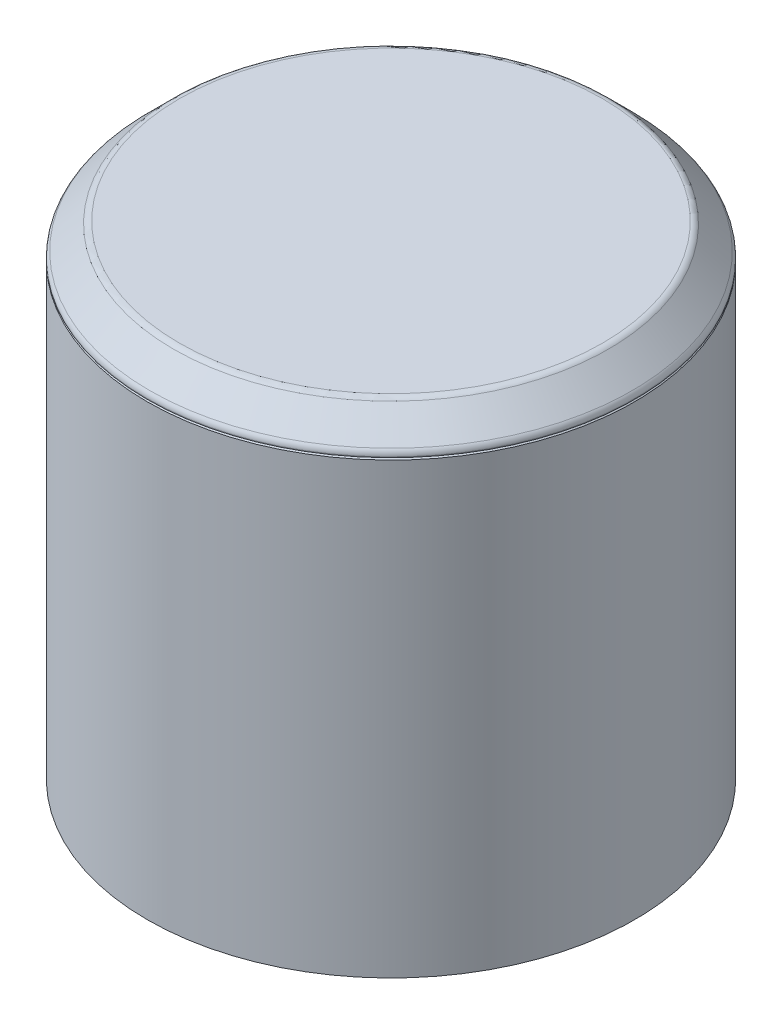
from build123d import *

# Parameters (mm, degrees)
IZIM2_R                     = 59.5
Y_KSEKLIK_EKSTR_ZYON1_DEPTH = 8
PAH1_SIZE                   = 0.5
PAH2_SIZE                   = 7
RADYUS1_R                   = 2


with BuildPart() as part:
    # Çizim1 → Döndür1 (revolve)
    with BuildSketch(Plane(origin=(0, 0, 0), x_dir=(0, 0, -1), z_dir=(1, 0, 0))):
        Polygon((0, -7), (0, 110), (-59.5, 110), (-59.5, 0), (-45, 0), (-45, -7), align=None)
    revolve(axis=Axis((0, 0, 0), (0, 1, 0)))

    # Pah1
    pah1_edges = [part.edges().sort_by_distance(p)[0] for p in [
        (0, 110, -59.5),
    ]]
    chamfer(pah1_edges, length=PAH1_SIZE)


with BuildPart() as body_2:
    # Çizim2 → Yükseklik-Ekstrüzyon1 (new body)
    with BuildSketch(Plane(origin=(0, 110, 0), x_dir=(1, 0, 0), z_dir=(0, 1, 0))):
        Circle(IZIM2_R)
    extrude(amount=Y_KSEKLIK_EKSTR_ZYON1_DEPTH)

    # Pah2
    pah2_edges = [body_2.edges().sort_by_distance(p)[0] for p in [
        (-59.5, 118, 0),
    ]]
    chamfer(pah2_edges, length=PAH2_SIZE)

    # Radyus1
    radyus1_edges = [body_2.edges().sort_by_distance(p)[0] for p in [
        (-59.5, 111, 0),
        (-52.5, 118, 0),
    ]]
    fillet(radyus1_edges, radius=RADYUS1_R)


solid = Compound([part.part, body_2.part])
